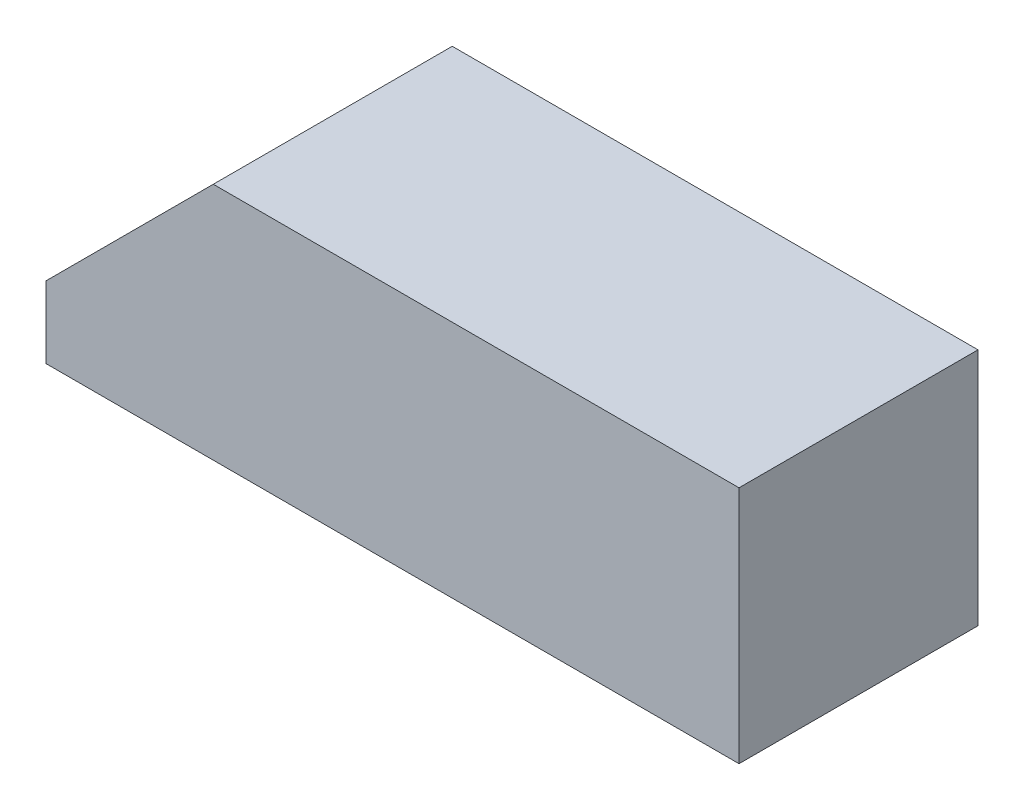
from build123d import *

# Parameters (mm, degrees)
SKETCH1_W                      = 145
SKETCH1_H                      = 50
BOSS_EXTRUDE1_DEPTH            = 25
CUT_EXTRUDE1_DEPTH             = 81.661329025
CUT_EXTRUDE1_DEPTH_BACK        = 81.661329025
F_12_0_12_DIAMETER_HOLE1_D     = 12
F_12_0_12_DIAMETER_HOLE1_DEPTH = 18
M10_TAPPED_HOLE2_D             = 8.5
M10_TAPPED_HOLE2_DEPTH         = 24.946342369
M10_TAPPED_HOLE2_TIP           = 2.553657631


with BuildPart() as part:
    # Sketch1 → Boss-Extrude1 (new, symmetric)
    with BuildSketch(Plane.XY):
        Rectangle(SKETCH1_W, SKETCH1_H)
    extrude(amount=BOSS_EXTRUDE1_DEPTH, both=True)

    # Sketch2 → Cut-Extrude1 (cut, two sides: drawn at the far end of the back side and taken through both)
    with BuildSketch(Plane.XY.offset(-CUT_EXTRUDE1_DEPTH_BACK)):
        Polygon((-72.5, -10), (-37.5, 25), (-72.5, 25), align=None)
    extrude(amount=CUT_EXTRUDE1_DEPTH + CUT_EXTRUDE1_DEPTH_BACK, mode=Mode.SUBTRACT)

    # Ø12.0 (12) Diameter Hole1
    with Locations(Plane.ZY.offset(72.5)):
        with Locations((0, -5)):
            Hole(F_12_0_12_DIAMETER_HOLE1_D / 2, depth=F_12_0_12_DIAMETER_HOLE1_DEPTH)

    # M10 Tapped Hole2
    with Locations(Plane.ZY.offset(54.5)):
        with Locations((0, -5)):
            Hole(M10_TAPPED_HOLE2_D / 2, depth=M10_TAPPED_HOLE2_DEPTH)
            with Locations((0, 0, -(M10_TAPPED_HOLE2_DEPTH + M10_TAPPED_HOLE2_TIP / 2))):  # 118° drill point
                Cone(0, M10_TAPPED_HOLE2_D / 2, M10_TAPPED_HOLE2_TIP, mode=Mode.SUBTRACT)


solid = part.part
